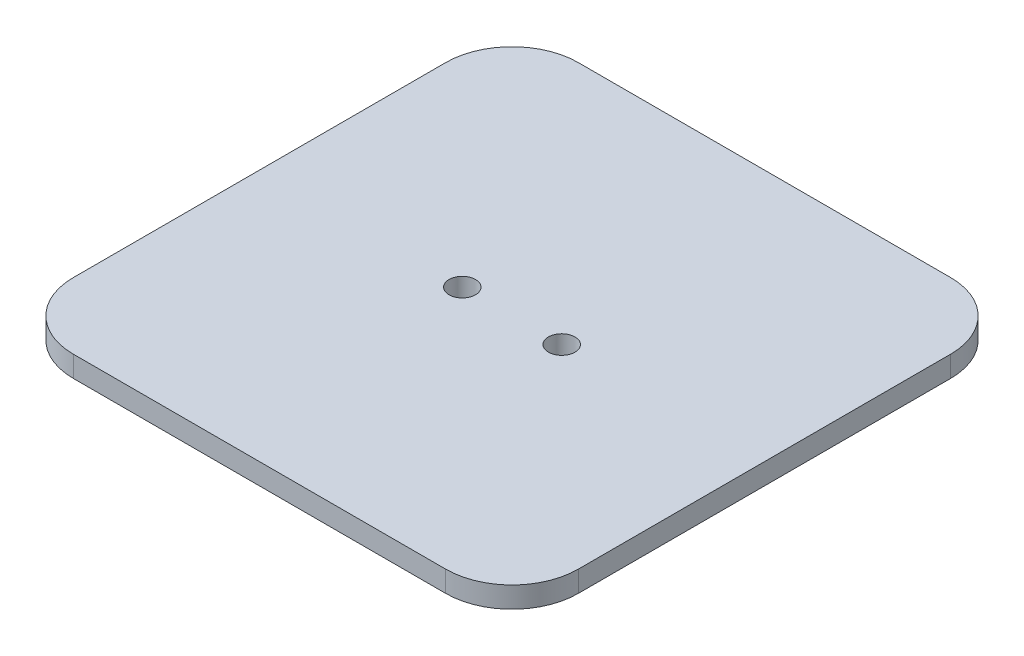
from build123d import *

# Parameters (mm, degrees)
SKETCH1_W           = 76.2
SKETCH1_H           = 76.2
BOSS_EXTRUDE1_DEPTH = 3.175
FILLET1_R           = 10
FILLET2_R           = 10
FILLET3_R           = 10
FILLET4_R           = 10
SKETCH2_R           = 2
CUT_EXTRUDE1_DEPTH  = 54.975


with BuildPart() as part:
    # Sketch1 → Boss-Extrude1 (new body)
    with BuildSketch(Plane(origin=(0, 0, 0), x_dir=(1, 0, 0), z_dir=(0, 1, 0))):
        Rectangle(SKETCH1_W, SKETCH1_H)
    extrude(amount=BOSS_EXTRUDE1_DEPTH)

    # Fillet1
    fillet1_edges = [part.edges().sort_by_distance(p)[0] for p in [
        (-38.1, 1.5875, 38.1),
    ]]
    fillet(fillet1_edges, radius=FILLET1_R)

    # Fillet2
    fillet2_edges = [part.edges().sort_by_distance(p)[0] for p in [
        (-38.1, 1.5875, -38.1),
    ]]
    fillet(fillet2_edges, radius=FILLET2_R)

    # Fillet3
    fillet3_edges = [part.edges().sort_by_distance(p)[0] for p in [
        (38.1, 1.5875, -38.1),
    ]]
    fillet(fillet3_edges, radius=FILLET3_R)

    # Fillet4
    fillet4_edges = [part.edges().sort_by_distance(p)[0] for p in [
        (38.1, 1.5875, 38.1),
    ]]
    fillet(fillet4_edges, radius=FILLET4_R)

    # Sketch2 → Cut-Extrude1 (cut, through all)
    with BuildSketch(Plane(origin=(0, 3.175, 0), x_dir=(1, 0, 0), z_dir=(0, 1, 0))):
        with Locations((7.5, 0)):
            Circle(SKETCH2_R)
        with Locations((-7.5, 0)):
            Circle(SKETCH2_R)
    extrude(amount=-CUT_EXTRUDE1_DEPTH, mode=Mode.SUBTRACT)


solid = part.part
